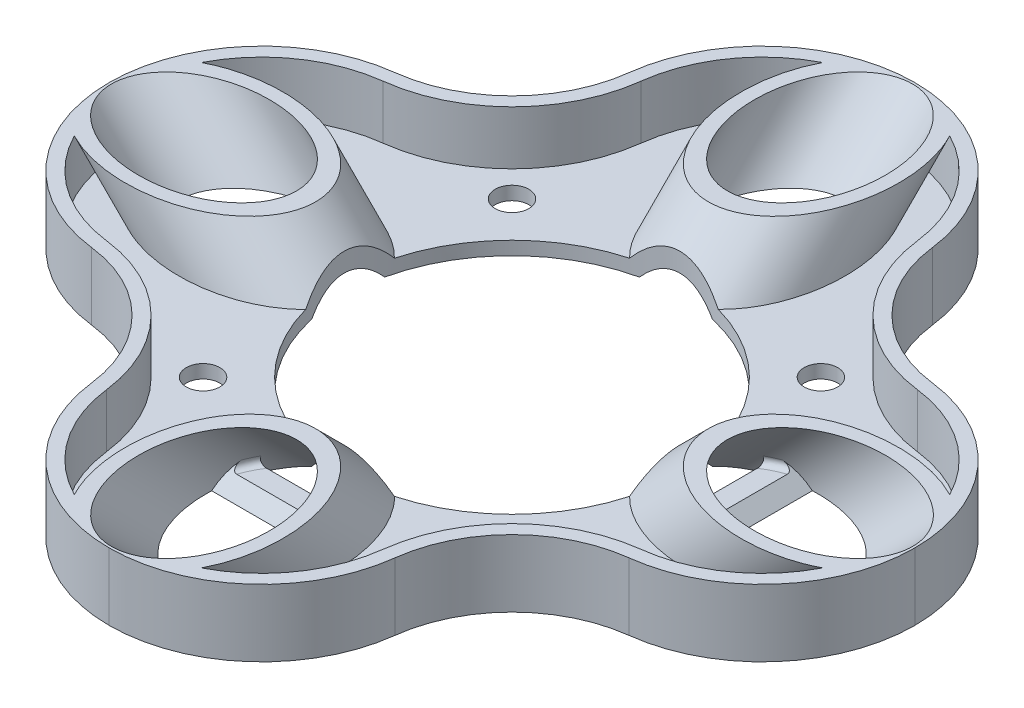
from build123d import *

# Parameters (mm, degrees)
BOSS_EXTRUDE1_DEPTH            = 12.7
CUT_EXTRUDE1_REACH             = 137.896
SKETCH3_R                      = 12.3825
CUT_EXTRUDE1_DIRECTION_2_REACH = 137.896
CIRPATTERN2_COUNT              = 4
SHELL2_T                       = -2.54
SKETCH8_W                      = 88.9
SKETCH8_H                      = 88.9
SKETCH8_W_2                    = 76.2
SKETCH8_H_2                    = 76.2
BOSS_EXTRUDE5_DEPTH            = 2.54
CHAMFER1_SIZE                  = 2.54
CUT_EXTRUDE2_REACH             = 110.509
SKETCH6_R                      = 31.75
FILLET5_R                      = 1.016
CUT_EXTRUDE3_REACH             = 110.509
SKETCH11_R                     = 3.175
CIRPATTERN3_COUNT              = 4
CUT_EXTRUDE4_REACH             = 110.509


with BuildPart() as part:
    # Sketch1 → Boss-Extrude1 (new body)
    with BuildSketch(Plane(origin=(0, 0, 0), x_dir=(1, 0, 0), z_dir=(0, 1, 0))):
        with BuildLine():
            ThreePointArc((-28.670812184, -50.808424156), (-35.923950409, -35.918098387), (-50.814170672, -28.664743565))
            ThreePointArc((-50.814170672, -28.664743565), (-68.941208108, -19.14489393), (-76.2, 0))
            ThreePointArc((-76.2, 0), (-68.939544936, 19.149070442), (-50.808424156, 28.670812184))
            ThreePointArc((-50.808424156, 28.670812184), (-35.918098387, 35.923950409), (-28.664743565, 50.814170672))
            ThreePointArc((-28.664743565, 50.814170672), (-19.14489393, 68.941208108), (0, 76.2))
            ThreePointArc((0, 76.2), (19.149070442, 68.939544936), (28.670812184, 50.808424156))
            ThreePointArc((28.670812184, 50.808424156), (35.923950409, 35.918098387), (50.814170672, 28.664743565))
            ThreePointArc((50.814170672, 28.664743565), (68.941208108, 19.14489393), (76.2, 0))
            ThreePointArc((76.2, 0), (68.939544936, -19.149070442), (50.808424156, -28.670812184))
            ThreePointArc((50.808424156, -28.670812184), (35.918098387, -35.923950409), (28.664743565, -50.814170672))
            ThreePointArc((28.664743565, -50.814170672), (19.14489393, -68.941208108), (0, -76.2))
            ThreePointArc((0, -76.2), (-19.149070442, -68.939544936), (-28.670812184, -50.808424156))
        make_face()
    extrude(amount=BOSS_EXTRUDE1_DEPTH)

    # Cut-Extrude1: up to this face of the body (flat: up to its plane)
    cut_extrude1_end = Plane(part.part.faces().sort_by_distance((0, 0, 0))[0])
    # Sketch3 → Cut-Extrude1 (cut, up to the picked face)
    with BuildSketch(Plane(origin=(-31.75, 31.75, 0), x_dir=(0, 0, -1), z_dir=(-0.7071067811865438, 0.7071067811865512, 0)), mode=Mode.PRIVATE) as cut_extrude1_sk1:
        with Locations(Location((0, 32.201280605, 0), (0, 0, 90))):
            Circle(SKETCH3_R)
    cut_extrude1_tool1 = split(extrude(cut_extrude1_sk1.sketch, amount=-CUT_EXTRUDE1_REACH, mode=Mode.PRIVATE), bisect_by=cut_extrude1_end, keep=Keep.BOTH, mode=Mode.PRIVATE)
    cut_extrude1 = cut_extrude1_tool1.solids().sort_by(Axis((-54.519744, 8.980256, 0), (0.7071067811865438, -0.7071067811865512, 0)))[0]
    add(cut_extrude1, mode=Mode.SUBTRACT)

    # Cut-Extrude1 direction 2: up to this face of the body (flat: up to its plane)
    cut_extrude1_direction_2_end = Plane(part.part.faces().sort_by_distance((0, 12.7, 0))[0])
    # Sketch3 → Cut-Extrude1 direction 2 (cut, up to the picked face)
    with BuildSketch(Plane(origin=(-31.75, 31.75, 0), x_dir=(0, 0, -1), z_dir=(-0.7071067811865438, 0.7071067811865512, 0)), mode=Mode.PRIVATE) as cut_extrude1_direction_2_sk1:
        with Locations(Location((0, 32.201280605, 0), (0, 0, 90))):
            Circle(SKETCH3_R)
    cut_extrude1_direction_2_tool1 = split(extrude(cut_extrude1_direction_2_sk1.sketch, amount=CUT_EXTRUDE1_DIRECTION_2_REACH, mode=Mode.PRIVATE), bisect_by=cut_extrude1_direction_2_end, keep=Keep.BOTH, mode=Mode.PRIVATE)
    cut_extrude1_direction_2 = cut_extrude1_direction_2_tool1.solids().sort_by(Axis((-54.519744, 8.980256, 0), (-0.7071067811865438, 0.7071067811865512, 0)))[0]
    add(cut_extrude1_direction_2, mode=Mode.SUBTRACT)

    # CirPattern2: Cut-Extrude1, Cut-Extrude1 direction 2 ×4 about axis
    cirpattern2_axis = Axis((0, 0, 0), (0, -1, 0))
    add([cut_extrude1.rotate(cirpattern2_axis, i * 360 / CIRPATTERN2_COUNT) for i in range(1, CIRPATTERN2_COUNT)], mode=Mode.SUBTRACT)
    add([cut_extrude1_direction_2.rotate(cirpattern2_axis, i * 360 / CIRPATTERN2_COUNT) for i in range(1, CIRPATTERN2_COUNT)], mode=Mode.SUBTRACT)

    # Shell2
    shell2_openings = [part.faces().sort_by_distance(p)[0] for p in [
        (0, 12.7, 0),
    ]]
    offset(amount=SHELL2_T, openings=shell2_openings)

    # Sketch8 → Boss-Extrude5 (add)
    with BuildSketch(Plane.XZ):
        Rectangle(SKETCH8_W, SKETCH8_H)
        Rectangle(SKETCH8_W_2, SKETCH8_H_2, mode=Mode.SUBTRACT)
    extrude(amount=-BOSS_EXTRUDE5_DEPTH)

    # Chamfer1
    chamfer1_edges = [part.edges().sort_by_distance(p)[0] for p in [
        (44.45, 2.54, 0),
        (-44.45, 2.54, 0),
        (0, 2.54, 44.45),
        (0, 2.54, -44.45),
    ]]
    chamfer(chamfer1_edges, length=CHAMFER1_SIZE - 0.0001)  # a hair under: the kernel refuses the full size

    # Sketch6 → Cut-Extrude2 (cut, up to next)
    with BuildSketch(Plane.XZ, mode=Mode.PRIVATE) as cut_extrude2_sk1:
        with Locations(Location((0, 0, 0), (0, 0, 282.539844087))):
            Circle(SKETCH6_R)
    cut_extrude2_tool1 = extrude(cut_extrude2_sk1.sketch, amount=-CUT_EXTRUDE2_REACH, mode=Mode.PRIVATE) & part.part
    add(cut_extrude2_tool1.solids().sort_by_distance((0, 0, 0))[0], mode=Mode.SUBTRACT)

    # Fillet5
    fillet5_edges = [part.edges().sort_by_distance(p)[0] for p in [
        (39.970447613, 2.54, -10.974882242),
        (-10.974882242, 2.54, -39.970447613),
        (10.974882242, 2.54, 39.970447613),
        (-39.970447613, 2.54, 10.974882242),
        (-10.974882241, 2.54, 39.970447612),
        (10.974882241, 2.54, -39.970447612),
        (39.970447612, 2.54, 10.974882241),
        (-39.970447612, 2.54, -10.974882241),
    ]]
    fillet(fillet5_edges, radius=FILLET5_R)

    # Sketch11 → Cut-Extrude3 (cut, up to next)
    with BuildSketch(Plane.XZ, mode=Mode.PRIVATE) as cut_extrude3_sk1:
        with Locations(Location((-29.21, 29.21, 0), (0, 0, 270))):
            Circle(SKETCH11_R)
    cut_extrude3_tool1 = extrude(cut_extrude3_sk1.sketch, amount=-CUT_EXTRUDE3_REACH, mode=Mode.PRIVATE) & part.part
    cut_extrude3 = cut_extrude3_tool1.solids().sort_by_distance((-29.21, 0, 29.21))[0]
    add(cut_extrude3, mode=Mode.SUBTRACT)

    # CirPattern3: Cut-Extrude3 ×4 about axis
    cirpattern3_axis = Axis((0, 0, 0), (0, 1, 0))
    for i in range(1, CIRPATTERN3_COUNT):
        add(cut_extrude3.rotate(cirpattern3_axis, i * 360 / CIRPATTERN3_COUNT), mode=Mode.SUBTRACT)

    # Sketch12 → Cut-Extrude4 (cut, up to next)
    with BuildSketch(Plane.XZ, mode=Mode.PRIVATE) as cut_extrude4_sk1:
        with BuildLine():
            ThreePointArc((-50.814170672, 28.664743565), (-35.923950409, 35.918098387), (-28.670812184, 50.808424156))
            ThreePointArc((-28.670812184, 50.808424156), (-46.900244299, 46.894232615), (-50.814170672, 28.664743565))
        make_face()
    cut_extrude4_tool1 = extrude(cut_extrude4_sk1.sketch, amount=-CUT_EXTRUDE4_REACH, mode=Mode.PRIVATE) & part.part
    # Sketch12 → Cut-Extrude4 (cut, up to next)
    with BuildSketch(Plane.XZ, mode=Mode.PRIVATE) as cut_extrude4_sk2:
        with BuildLine():
            ThreePointArc((-28.664743565, -50.814170672), (-35.918098387, -35.923950409), (-50.808424156, -28.670812184))
            ThreePointArc((-50.808424156, -28.670812184), (-48.321422887, -48.327455332), (-28.664743565, -50.814170672))
        make_face()
    cut_extrude4_tool2 = extrude(cut_extrude4_sk2.sketch, amount=-CUT_EXTRUDE4_REACH, mode=Mode.PRIVATE) & part.part
    # Sketch12 → Cut-Extrude4 (cut, up to next)
    with BuildSketch(Plane.XZ, mode=Mode.PRIVATE) as cut_extrude4_sk3:
        with BuildLine():
            ThreePointArc((50.814170672, -28.664743565), (35.923950409, -35.918098387), (28.670812184, -50.808424156))
            ThreePointArc((28.670812184, -50.808424156), (50.814331724, -50.808263104), (50.814170672, -28.664743565))
        make_face()
    cut_extrude4_tool3 = extrude(cut_extrude4_sk3.sketch, amount=-CUT_EXTRUDE4_REACH, mode=Mode.PRIVATE) & part.part
    # Sketch12 → Cut-Extrude4 (cut, up to next)
    with BuildSketch(Plane.XZ, mode=Mode.PRIVATE) as cut_extrude4_sk4:
        with BuildLine():
            ThreePointArc((28.664743565, 50.814170672), (35.918098387, 35.923950409), (50.808424156, 28.670812184))
            ThreePointArc((50.808424156, 28.670812184), (45.926913189, 45.932910803), (28.664743565, 50.814170672))
        make_face()
    cut_extrude4_tool4 = extrude(cut_extrude4_sk4.sketch, amount=-CUT_EXTRUDE4_REACH, mode=Mode.PRIVATE) & part.part
    add(cut_extrude4_tool1.solids().sort_by_distance((-41.183701, 0, 41.177773))[0], mode=Mode.SUBTRACT)
    add(cut_extrude4_tool2.solids().sort_by_distance((-41.825474, 0, -41.831412))[0], mode=Mode.SUBTRACT)
    add(cut_extrude4_tool3.solids().sort_by_distance((43.002707, 0, -42.996752))[0], mode=Mode.SUBTRACT)
    add(cut_extrude4_tool4.solids().sort_by_distance((40.74963, 0, 40.755553))[0], mode=Mode.SUBTRACT)


solid = part.part
